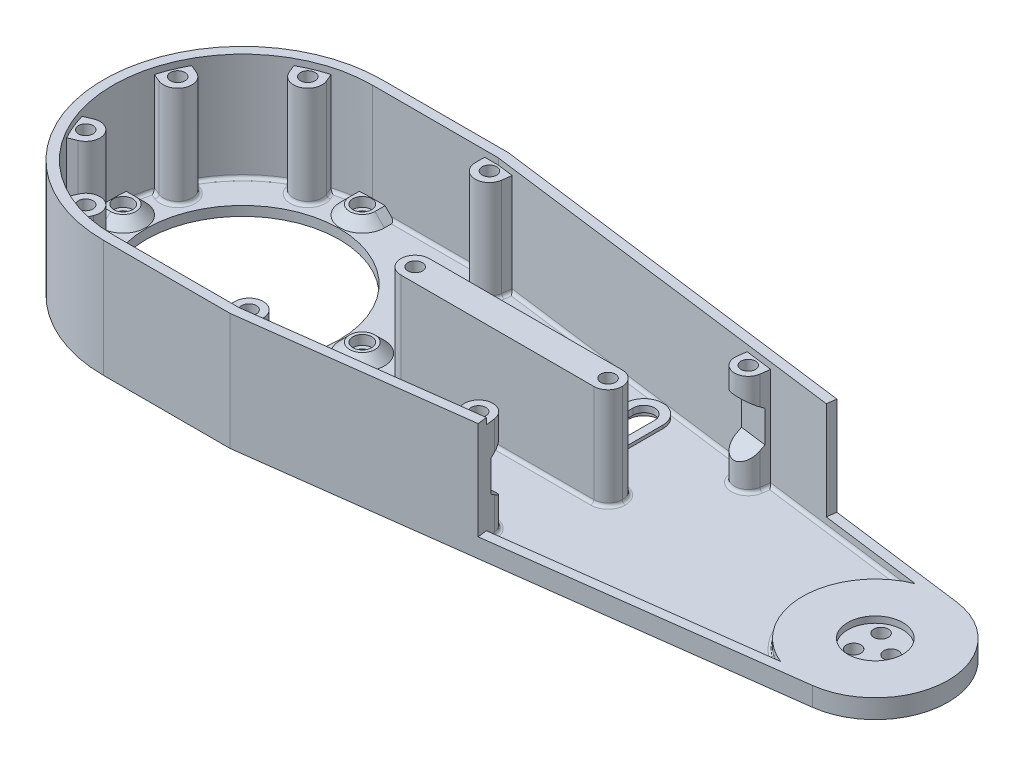
from build123d import *

# Parameters (mm, degrees)
SKETCH1_R              = 30.5
SKETCH1_R_2            = 1.6999999999999995
SKETCH1_R_3            = 1.6999999999999997
BOSS_EXTRUDE1_DEPTH    = 3
BOSS_EXTRUDE2_DEPTH    = 34
SKETCH3_R              = 4.000000000000006
SKETCH3_R_2            = 3.0000000000000013
SKETCH3_R_3            = 2.9999999999999982
SKETCH3_R_4            = 2.999999999999999
BOSS_EXTRUDE3_DEPTH    = 3
BOSS_EXTRUDE6_DEPTH    = 3
SKETCH4_R              = 8.699999999999998
CUT_EXTRUDE1_DEPTH     = 1
SKETCH5_R              = 8.699999999999998
BOSS_EXTRUDE4_DEPTH    = 3
BOSS_EXTRUDE5_DEPTH    = 32
SKETCH10_R             = 2.2999999999999994
SKETCH10_R_2           = 2.3000000000000003
SKETCH10_R_3           = 2.300000000000007
SKETCH10_R_4           = 2.3000000000000074
SKETCH10_R_5           = 2.3000000000000216
SKETCH10_R_6           = 2.300000000000006
CUT_EXTRUDE3_DEPTH     = 7
CHAMFER1_SIZE          = 3
CUT_EXTRUDE5_DEPTH     = 9
CUT_EXTRUDE6_DEPTH     = 8.6
SKETCH15_R             = 2.3000000000000065
SKETCH15_R_2           = 2.3000000000000074
CUT_EXTRUDE7_DEPTH     = 8
FILLET1_R              = 4.5
CUT_EXTRUDE8_START     = -2
CUT_EXTRUDE8_OUTLINE_W = 72.00000000000001
CUT_EXTRUDE8_OUTLINE_H = 12
CUT_EXTRUDE8_OUTLINE_R = 2.3
CUT_EXTRUDE8_DEPTH     = 2
SKETCH18_R             = 8.699999999999998
BOSS_EXTRUDE7_DEPTH    = 2
CUT_EXTRUDE9_REACH     = 231.682
SKETCH19_R             = 2.300000000000006
BOSS_EXTRUDE8_DEPTH    = 31
CUT_EXTRUDE10_DEPTH    = 10
BOSS_EXTRUDE9_START    = 1
BOSS_EXTRUDE9_DEPTH    = 1
CUT_EXTRUDE13_DEPTH    = 2
FILLET3_R              = 1


# Read off the part's stored shape, not the designer's step: Cut-Extrude8
# Some blends are built 0.0001 mm under size
with BuildPart() as part:
    # Sketch1 → Boss-Extrude1 (new body)
    with BuildSketch(Plane(origin=(0, 0, 0), x_dir=(1, 0, 0), z_dir=(0, 1, 0))):
        with BuildLine():
            Line((0, 44.00000000000001), (40.00000000000001, 44))
            Line((40.00000000000001, 44), (202.96593996902774, 22.807963523737147))
            ThreePointArc((202.96593996902774, 22.807963523737147), (223, 0), (202.96593996902774, -22.807963523737147))
            Line((202.96593996902774, -22.807963523737147), (40.00000000000001, -44))
            Line((40.00000000000001, -44), (0, -44.00000000000001))
            ThreePointArc((0, -44.00000000000001), (-44.00000000000001, 5.39e-15), (0, 44.00000000000001))
        make_face()
        with Locations(Location((0, 0, 0), (0, 0, 270))):
            Circle(SKETCH1_R, mode=Mode.SUBTRACT)
        with Locations(Location((-37.8, -8.39e-15, 0), (0, 0, 270))):
            Circle(SKETCH1_R_2, mode=Mode.SUBTRACT)
        with Locations(Location((-1.041e-14, 37.8, 0), (0, 0, 270))):
            Circle(SKETCH1_R_3, mode=Mode.SUBTRACT)
        with Locations(Location((37.8, 1.301e-14, 0), (0, 0, 270))):
            Circle(SKETCH1_R_2, mode=Mode.SUBTRACT)
        with Locations(Location((1.561e-14, -37.8, 0), (0, 0, 270))):
            Circle(SKETCH1_R_3, mode=Mode.SUBTRACT)
    extrude(amount=BOSS_EXTRUDE1_DEPTH)

    # Sketch2 → Boss-Extrude2 (add)
    with BuildSketch(Plane(origin=(0, 3, 0), x_dir=(1, 0, 0), z_dir=(0, 1, 0))):
        with BuildLine():
            Line((0, -44.00000000000001), (40.00000000000001, -44))
            Line((40.00000000000001, -44), (109.41554115919999, -34.97322618122002))
            Line((109.41554115919999, -34.97322618122002), (109.02867942410941, -31.998274417254336))
            Line((109.02867942410941, -31.998274417254336), (39.805758230172025, -41))
            Line((39.805758230172025, -41), (-7.53e-15, -41))
            ThreePointArc((-7.53e-15, -41), (-41, 5.02e-15), (5.5e-16, 41))
            Line((5.5e-16, 41), (39.80575823017201, 40.99999999999994))
            Line((39.80575823017201, 40.99999999999994), (138.77819706376658, 28.129657066348578))
            Line((138.77819706376658, 28.129657066348578), (139.16505879885716, 31.104608830314316))
            Line((139.16505879885716, 31.104608830314316), (40.00000000000001, 44))
            Line((40.00000000000001, 44), (0, 44.00000000000001))
            ThreePointArc((0, 44.00000000000001), (-44.00000000000001, 5.39e-15), (0, -44.00000000000001))
        make_face()
        Polygon((50, 4.500000000000011), (120.00000000000001, 4.500000000000014), (120.00000000000001, -4.499999999999985), (50, -4.4999999999999885), align=None)
    extrude(amount=BOSS_EXTRUDE2_DEPTH)

    # Sketch3 → Boss-Extrude3 (add)
    # profile 1 of 4: a face of its own
    with BuildSketch(Plane(origin=(0, 3, 0), x_dir=(1, 0, 0), z_dir=(0, 1, 0))):
        with Locations(Location((37.8, 1.301e-14, 0), (0, 0, 270))):
            Circle(SKETCH3_R)
        with Locations(Location((37.8, 1.301e-14, 0), (0, 0, 270))):
            Circle(SKETCH3_R_2, mode=Mode.SUBTRACT)
    # profile 2 of 4: a face of its own
    with BuildSketch(Plane(origin=(0, 3, 0), x_dir=(1, 0, 0), z_dir=(0, 1, 0))):
        with BuildLine():
            Line((-37.8, 3.9999999999999973), (-40.80441152620634, 3.9999999999999973))
            ThreePointArc((-40.80441152620634, 3.9999999999999973), (-41.00000000000001, -1.319e-14), (-40.80441152620633, -4.000000000000015))
            Line((-40.80441152620633, -4.000000000000015), (-37.8, -4.000000000000015))
            ThreePointArc((-37.8, -4.000000000000015), (-33.79999999999999, -8.39e-15), (-37.8, 3.9999999999999973))
        make_face()
        with Locations(Location((-37.8, -8.39e-15, 0), (0, 0, 270))):
            Circle(SKETCH3_R_2, mode=Mode.SUBTRACT)
    # profile 3 of 4: a face of its own
    with BuildSketch(Plane(origin=(0, 3, 0), x_dir=(1, 0, 0), z_dir=(0, 1, 0))):
        with BuildLine():
            Line((-3.999999999999883, 37.80000000000001), (-3.9999999999998725, 40.804411526206344))
            ThreePointArc((-3.9999999999998725, 40.804411526206344), (1.2996e-13, 41.00000000000001), (4.000000000000139, 40.80441152620632))
            Line((4.000000000000139, 40.80441152620632), (4.00000000000013, 37.79999999999998))
            ThreePointArc((4.00000000000013, 37.79999999999998), (1.0864e-13, 33.79999999999999), (-3.999999999999883, 37.80000000000001))
        make_face()
        with Locations(Location((1.2358e-13, 37.8, 0), (0, 0, 270))):
            Circle(SKETCH3_R_3, mode=Mode.SUBTRACT)
    # profile 4 of 4: a face of its own
    with BuildSketch(Plane(origin=(0, 3, 0), x_dir=(1, 0, 0), z_dir=(0, 1, 0))):
        with BuildLine():
            Line((3.9999999999996194, -37.80000000000004), (3.999999999999587, -40.804411526206366))
            ThreePointArc((3.999999999999587, -40.804411526206366), (-4.1627e-13, -41.00000000000001), (-4.000000000000425, -40.804411526206295))
            Line((-4.000000000000425, -40.804411526206295), (-4.000000000000393, -37.79999999999996))
            ThreePointArc((-4.000000000000393, -37.79999999999996), (-3.4822e-13, -33.79999999999999), (3.9999999999996194, -37.80000000000004))
        make_face()
        with Locations(Location((-3.8754e-13, -37.8, 0), (0, 0, 270))):
            Circle(SKETCH3_R_4, mode=Mode.SUBTRACT)
    extrude(amount=BOSS_EXTRUDE3_DEPTH)

    # Sketch16 → Boss-Extrude6 (add)
    with BuildSketch(Plane(origin=(0, 3, 0), x_dir=(1, 0, 0), z_dir=(0, 1, 0))):
        with BuildLine():
            Line((4.000000000000139, 40.80441152620632), (4.000000000000139, 40.99999999999999))
            Line((4.000000000000139, 40.99999999999999), (5.718e-14, 40.99999999999999))
            ThreePointArc((5.718e-14, 40.99999999999999), (2.002389500764186, 40.95107368906498), (4.000000000000139, 40.80441152620632))
        make_face()
        with BuildLine():
            Line((3.999999999999583, -40.80441152620636), (3.9999999999995888, -41))
            Line((3.9999999999995888, -41), (-7.53e-15, -41))
            ThreePointArc((-7.53e-15, -41), (2.0023895007638766, -40.951073689064984), (3.999999999999583, -40.80441152620636))
        make_face()
    extrude(amount=BOSS_EXTRUDE6_DEPTH)

    # Sketch4 → Cut-Extrude1 (cut)
    with BuildSketch(Plane(origin=(0, 3, 0), x_dir=(1, 0, 0), z_dir=(0, 1, 0))):
        with Locations(Location((200, 0, 0), (0, 0, 270))):
            Circle(SKETCH4_R)
    extrude(amount=-CUT_EXTRUDE1_DEPTH, mode=Mode.SUBTRACT)

    # Sketch5 → Boss-Extrude4 (add)
    with BuildSketch(Plane(origin=(0, 3, 0), x_dir=(1, 0, 0), z_dir=(0, 1, 0))):
        with BuildLine():
            Line((109.41554115919999, -34.97322618122002), (109.02867942410941, -31.998274417254336))
            Line((109.02867942410941, -31.998274417254336), (191.31609263344478, -21.297646650489078))
            ThreePointArc((191.31609263344478, -21.297646650489078), (177, 3.3988e-13), (191.3160926334454, 21.297646650489323))
            Line((191.3160926334454, 21.297646650489323), (138.77819706376658, 28.129657066348578))
            Line((138.77819706376658, 28.129657066348578), (139.16505879885716, 31.104608830314316))
            Line((139.16505879885716, 31.104608830314316), (202.96593996902774, 22.807963523737147))
            ThreePointArc((202.96593996902774, 22.807963523737147), (223.00000000000003, -5.11e-15), (202.96593996902774, -22.80796352373717))
            Line((202.96593996902774, -22.80796352373717), (109.41554115919999, -34.97322618122002))
        make_face()
        with Locations(Location((200, 0, 0), (0, 0, 270))):
            Circle(SKETCH5_R, mode=Mode.SUBTRACT)
    extrude(amount=BOSS_EXTRUDE4_DEPTH)

    # Sketch7 → Boss-Extrude5 (add)
    with BuildSketch(Plane(origin=(0, 3, 0), x_dir=(1, 0, 0), z_dir=(0, 1, 0))):
        with BuildLine():
            Line((-33.38534678978598, 18.699428326174232), (-35.92814093391829, 19.75268814699673))
            ThreePointArc((-35.92814093391829, 19.75268814699673), (-37.87906083296274, 15.690020726968717), (-39.37229182520411, 11.437772354395154))
            Line((-39.37229182520411, 11.437772354395154), (-36.82949768107179, 10.384512533572654))
            ThreePointArc((-36.82949768107179, 10.384512533572654), (-30.949964339128098, 12.819894984230533), (-33.38534678978598, 18.699428326174232))
        make_face()
        with BuildLine():
            Line((-10.38451253357259, 36.82949768107181), (-11.437772354395067, 39.37229182520414))
            ThreePointArc((-11.437772354395067, 39.37229182520414), (-15.690020726968635, 37.879060832962786), (-19.75268814699666, 35.928140933918336))
            Line((-19.75268814699666, 35.928140933918336), (-18.699428326174175, 33.38534678978601))
            ThreePointArc((-18.699428326174175, 33.38534678978601), (-12.819894984230487, 30.949964339128123), (-10.38451253357259, 36.82949768107181))
        make_face()
        with BuildLine():
            Line((-18.699428326174225, -33.385346789785984), (-19.752688146996732, -35.92814093391828))
            ThreePointArc((-19.752688146996732, -35.92814093391828), (-15.690020726968717, -37.87906083296273), (-11.437772354395138, -39.37229182520411))
            Line((-11.437772354395138, -39.37229182520411), (-10.384512533572646, -36.82949768107179))
            ThreePointArc((-10.384512533572646, -36.82949768107179), (-12.81989498423053, -30.949964339128098), (-18.699428326174225, -33.385346789785984))
        make_face()
        with BuildLine():
            Line((-36.829497681071814, -10.384512533572599), (-39.37229182520413, -11.437772354395063))
            ThreePointArc((-39.37229182520413, -11.437772354395063), (-37.87906083296277, -15.690020726968626), (-35.928140933918336, -19.752688146996658))
            Line((-35.928140933918336, -19.752688146996658), (-33.385346789786006, -18.699428326174182))
            ThreePointArc((-33.385346789786006, -18.699428326174182), (-30.949964339128123, -12.819894984230487), (-36.829497681071814, -10.384512533572599))
        make_face()
        with BuildLine():
            Line((35.50000000000001, 38), (35.50000000000001, 40.99999999999999))
            Line((35.50000000000001, 40.99999999999999), (39.80575823017201, 40.99999999999994))
            Line((39.80575823017201, 40.99999999999994), (44.8428292450037, 40.3449809653469))
            Line((44.8428292450037, 40.3449809653469), (44.46242764594859, 37.41970739736415))
            ThreePointArc((44.46242764594859, 37.41970739736415), (39.70924615803792, 33.50940291237521), (35.50000000000001, 38))
        make_face()
        with BuildLine():
            Line((35.50000000000001, -38), (35.50000000000001, -40.99999999999999))
            Line((35.50000000000001, -40.99999999999999), (39.80575823017201, -40.99999999999994))
            Line((39.80575823017201, -40.99999999999994), (44.8428292450037, -40.3449809653469))
            Line((44.8428292450037, -40.3449809653469), (44.46242764594859, -37.41970739736415))
            ThreePointArc((44.46242764594859, -37.41970739736415), (39.70924615803792, -33.50940291237521), (35.50000000000001, -38))
        make_face()
        with BuildLine():
            Line((99.71696239712172, -30.18390785856034), (100.10382413221228, -33.15885962252599))
            Line((100.10382413221228, -33.15885962252599), (109.02867942410941, -31.998274417254336))
            Line((109.02867942410941, -31.998274417254336), (108.64181768901885, -29.02332265328862))
            ThreePointArc((108.64181768901885, -29.02332265328862), (103.59909744043442, -25.141187609975912), (99.71696239712172, -30.18390785856034))
        make_face()
        with BuildLine():
            Line((138.39133532867604, 25.154705302382883), (138.77819706376658, 28.129657066348578))
            Line((138.77819706376658, 28.129657066348578), (130.25000200706492, 29.238660706941687))
            Line((130.25000200706492, 29.238660706941687), (129.86314027197434, 26.26370894297582))
            ThreePointArc((129.86314027197434, 26.26370894297582), (133.57273598002874, 21.445109594328464), (138.39133532867604, 25.154705302382883))
        make_face()
    extrude(amount=BOSS_EXTRUDE5_DEPTH)

    # Sketch10 → Cut-Extrude3 (cut)
    with BuildSketch(Plane(origin=(0, 35, 0), x_dir=(1, 0, 0), z_dir=(0, 1, 0))):
        with Locations(Location((-35.10742223542891, -14.541970429873391, 0), (0, 0, 270))):
            Circle(SKETCH10_R)
        with Locations(Location((-14.541970429873432, -35.107422235428885, 0), (0, 0, 270))):
            Circle(SKETCH10_R_2)
        with Locations(Location((-35.107422235428885, 14.54197042987344, 0), (0, 0, 270))):
            Circle(SKETCH10_R_3)
        with Locations(Location((-14.541970429873384, 35.10742223542891, 0), (0, 0, 270))):
            Circle(SKETCH10_R_2)
        with Locations(Location((40.00000000000001, -38, 0), (0, 0, 270))):
            Circle(SKETCH10_R_4)
        with Locations(Location((104.17939004307028, -29.603615255924478, 0), (0, 0, 270))):
            Circle(SKETCH10_R_5)
        with Locations(Location((40.00000000000001, 38, 0), (0, 0, 270))):
            Circle(SKETCH10_R_4)
        with Locations(Location((134.12723780032522, 25.709207122679338, 0), (0, 0, 270))):
            Circle(SKETCH10_R_6)
    extrude(amount=-CUT_EXTRUDE3_DEPTH, mode=Mode.SUBTRACT)

    # Chamfer1
    chamfer1_edges = [part.edges().sort_by_distance(p)[0] for p in [
        (37.8, 3, -4.0000000000000195),
        (3.999999999999604, 3, 39.40000000000002),
        (-4.000000000000409, 3, 39.30220576310313),
        (-3.4897e-13, 3, 33.79999999999999),
        (-3.999999999999878, 3, -39.302205763103174),
        (4.000000000000134, 3, -39.39999999999999),
        (1.0916e-13, 3, -33.79999999999998),
        (-39.30220576310316, 3, 4.000000000000015),
        (-39.30220576310317, 3, -3.9999999999999973),
        (-33.79999999999999, 3, 9.02e-15),
    ]]
    chamfer(chamfer1_edges, length=CHAMFER1_SIZE - 0.0001)  # a hair under: the kernel refuses the full size

    # Sketch13 → Cut-Extrude5 (cut)
    with BuildSketch(Plane(origin=(103.123778921788, 0, -13.410181814040275), x_dir=(-0.1289539116968592, 0, -0.9916505879885711), z_dir=(0.991650587988571, 0, -0.12895391169685919))):
        Polygon((-44.00337436634009, 25), (-44.00337436634009, 15), (-38.29078233937168, 11.000000000000055), (-38.29078233937168, 29.000000000000004), align=None)
    extrude(amount=-CUT_EXTRUDE5_DEPTH, mode=Mode.SUBTRACT)

    # Sketch14 → Cut-Extrude6 (cut)
    with BuildSketch(Plane(origin=(132.87329656144564, 0, 17.27879916494519), x_dir=(0.12895391169685194, 0, -0.9916505879885721), z_dir=(0.9916505879885721, 0, 0.12895391169685194))):
        Polygon((38.49078233937063, 29.000000000000004), (44.20337436633917, 25), (44.20337436633917, 15), (38.490782339370845, 11.000000000000052), align=None)
    extrude(amount=-CUT_EXTRUDE6_DEPTH, mode=Mode.SUBTRACT)

    # Sketch15 → Cut-Extrude7 (cut)
    with BuildSketch(Plane(origin=(0, 37.00000000000001, 0), x_dir=(1, 0, 0), z_dir=(0, 1, 0))):
        with Locations(Location((54.50000000000002, 0, 0), (0, 0, 270))):
            Circle(SKETCH15_R)
        with Locations(Location((115.49999999999999, 0, 0), (0, 0, 90))):
            Circle(SKETCH15_R_2)
    extrude(amount=-CUT_EXTRUDE7_DEPTH, mode=Mode.SUBTRACT)

    # Fillet1
    fillet1_edges = [part.edges().sort_by_distance(p)[0] for p in [
        (120.00000000000001, 20, -4.500000000000014),
        (120.00000000000001, 20, 4.499999999999985),
        (50, 20, -4.500000000000011),
        (50, 20, 4.4999999999999885),
    ]]
    fillet(fillet1_edges, radius=FILLET1_R - 0.0001)  # a hair under: the kernel refuses the full size

    # Cut-Extrude8 outline → Cut-Extrude8 (cut)
    with BuildSketch(Plane(origin=(0, 37.00000000000001, 0), x_dir=(1, 0, 0), z_dir=(0, 1, 0)).offset(CUT_EXTRUDE8_START)):
        with Locations((85, 0)):
            Rectangle(CUT_EXTRUDE8_OUTLINE_W, CUT_EXTRUDE8_OUTLINE_H)
        with Locations((54.5, 0)):
            Circle(CUT_EXTRUDE8_OUTLINE_R, mode=Mode.SUBTRACT)
        with Locations((115.5, 0)):
            Circle(CUT_EXTRUDE8_OUTLINE_R, mode=Mode.SUBTRACT)
    extrude(amount=CUT_EXTRUDE8_DEPTH, mode=Mode.SUBTRACT)

    # Sketch18 → Boss-Extrude7 (add)
    with BuildSketch(Plane(origin=(0, 2, 0), x_dir=(1, 0, 0), z_dir=(0, 1, 0))):
        with Locations(Location((200, 0, 0), (0, 0, 270))):
            Circle(SKETCH18_R)
    extrude(amount=BOSS_EXTRUDE7_DEPTH)

    # Sketch19 → Cut-Extrude9 (cut, up to next)
    with BuildSketch(Plane(origin=(0, 4, 0), x_dir=(1, 0, 0), z_dir=(0, 1, 0)), mode=Mode.PRIVATE) as cut_extrude9_sk1:
        with Locations(Location((205.00000000000003, 0, 0), (0, 0, 270))):
            Circle(SKETCH19_R)
    cut_extrude9_tool1 = extrude(cut_extrude9_sk1.sketch, amount=-CUT_EXTRUDE9_REACH, mode=Mode.PRIVATE) & part.part
    # Sketch19 → Cut-Extrude9 (cut, up to next)
    with BuildSketch(Plane(origin=(0, 4, 0), x_dir=(1, 0, 0), z_dir=(0, 1, 0)), mode=Mode.PRIVATE) as cut_extrude9_sk2:
        with Locations(Location((197.49999999999994, -4.330127018922214, 0), (0, 0, 270))):
            Circle(SKETCH19_R)
    cut_extrude9_tool2 = extrude(cut_extrude9_sk2.sketch, amount=-CUT_EXTRUDE9_REACH, mode=Mode.PRIVATE) & part.part
    # Sketch19 → Cut-Extrude9 (cut, up to next)
    with BuildSketch(Plane(origin=(0, 4, 0), x_dir=(1, 0, 0), z_dir=(0, 1, 0)), mode=Mode.PRIVATE) as cut_extrude9_sk3:
        with Locations(Location((197.5, 4.330127018922214, 0), (0, 0, 270))):
            Circle(SKETCH19_R)
    cut_extrude9_tool3 = extrude(cut_extrude9_sk3.sketch, amount=-CUT_EXTRUDE9_REACH, mode=Mode.PRIVATE) & part.part
    add(cut_extrude9_tool1.solids().sort_by_distance((205, 4, 0))[0], mode=Mode.SUBTRACT)
    add(cut_extrude9_tool2.solids().sort_by_distance((197.5, 4, 4.330127))[0], mode=Mode.SUBTRACT)
    add(cut_extrude9_tool3.solids().sort_by_distance((197.5, 4, -4.330127))[0], mode=Mode.SUBTRACT)

    # Sketch20 → Boss-Extrude8 (add)
    with BuildSketch(Plane(origin=(0, 6, 0), x_dir=(1, 0, 0), z_dir=(0, 1, 0))):
        Polygon((138.77819706376658, 28.129657066348578), (139.16505879885716, 31.104608830314316), (159.38701982151375, 28.47495176396575), (159.00015808642317, 25.5), align=None)
    extrude(amount=BOSS_EXTRUDE8_DEPTH)

    # Sketch21 → Cut-Extrude10 (cut)
    with BuildSketch(Plane(origin=(0, 3, 0), x_dir=(1, 0, 0), z_dir=(0, 1, 0))):
        with BuildLine():
            Line((103.4, 26.836180439024222), (103.40000000000002, 10.836180439024222))
            ThreePointArc((103.40000000000002, 10.836180439024222), (100, 7.436180439024216), (96.6, 10.836180439024222))
            Line((96.6, 10.836180439024222), (96.60000000000001, 26.836180439024222))
            ThreePointArc((96.60000000000001, 26.836180439024222), (100, 30.236180439024228), (103.4, 26.836180439024222))
        make_face()
    extrude(amount=-CUT_EXTRUDE10_DEPTH, mode=Mode.SUBTRACT)

    # Sketch22 → Boss-Extrude9 (add)
    with BuildSketch(Plane(origin=(0, 3, 0), x_dir=(1, 0, 0), z_dir=(0, 1, 0)).offset(BOSS_EXTRUDE9_START)):
        with BuildLine():
            Line((94.00000000000001, 26.836180439024222), (94.00000000000001, 10.83618043902422))
            ThreePointArc((94.00000000000001, 10.83618043902422), (100, 4.836180439024236), (106.00000000000001, 10.836180439024222))
            Line((106.00000000000001, 10.836180439024222), (106.00000000000001, 26.836180439024222))
            ThreePointArc((106.00000000000001, 26.836180439024222), (100, 32.83618043902423), (94.00000000000001, 26.836180439024222))
        make_face()
        with BuildLine():
            Line((96.60000000000001, 26.836180439024222), (96.6, 10.836180439024222))
            ThreePointArc((96.6, 10.836180439024222), (100, 7.436180439024216), (103.40000000000002, 10.836180439024222))
            Line((103.40000000000002, 10.836180439024222), (103.4, 26.836180439024222))
            ThreePointArc((103.4, 26.836180439024222), (100, 30.236180439024228), (96.60000000000001, 26.836180439024222))
        make_face(mode=Mode.SUBTRACT)
    extrude(amount=-BOSS_EXTRUDE9_DEPTH)

    # Sketch23 → Cut-Extrude13 (cut)
    with BuildSketch(Plane.XZ):
        with BuildLine():
            Line((95, -10.836180439024222), (94.99999999999999, -26.836180439024222))
            ThreePointArc((94.99999999999999, -26.836180439024222), (100, -31.836180439024236), (105.00000000000003, -26.836180439024222))
            Line((105.00000000000003, -26.836180439024222), (105.00000000000001, -10.83618043902422))
            ThreePointArc((105.00000000000001, -10.83618043902422), (100, -5.836180439024208), (95, -10.836180439024222))
        make_face()
    extrude(amount=-CUT_EXTRUDE13_DEPTH, mode=Mode.SUBTRACT)

    # Fillet3
    # the kernel refuses this fillet: 1 mm, written as the material it adds along each edge
    with BuildSketch(Plane(origin=(130.57238678630705, 3, -31.71778717691312), x_dir=(-0.991650587988572, 0, -0.12895391169685236), z_dir=(-0.12895391169685236, 0, 0.991650587988572))) as fillet3_piece_1:
        with BuildLine():
            CenterArc((FILLET3_R, -FILLET3_R), FILLET3_R, 90, 90)
            Line((4.6e-16, -FILLET3_R), (0, 0))
            Line((0, 0), (FILLET3_R, 0))
        make_face()
    extrude(amount=5.5000000000001545)
    with BuildSketch(Plane(origin=(138.39133532867604, 3, -25.154705302382883), x_dir=(0.9916505879885722, 0, 0.12895391169685033), z_dir=(0.1289539116968503, 0, -0.9916505879885722))) as fillet3_piece_2:
        with BuildLine():
            CenterArc((FILLET3_R, -FILLET3_R), FILLET3_R, 90, 90)
            Line((-9.2e-16, -FILLET3_R), (0, 0))
            Line((0, 0), (FILLET3_R, 0))
        make_face()
    extrude(amount=5.499999999999981)
    with BuildSketch(Plane(origin=(35.50000000000001, 3, -38), x_dir=(-1, 0, 0), z_dir=(0, 0, -1))) as fillet3_piece_3:
        with BuildLine():
            CenterArc((FILLET3_R, FILLET3_R), FILLET3_R, 180, 90)
            Line((0, FILLET3_R), (0, 0))
            Line((0, 0), (FILLET3_R, 0))
        make_face()
    extrude(amount=5.499999999999993)
    with BuildSketch(Plane(origin=(45.16521402424584, 3, -42.82410743531833), x_dir=(0.9916505879885714, 0, 0.1289539116968562), z_dir=(-0.12895391169685616, 0, 0.9916505879885714))) as fillet3_piece_4:
        with BuildLine():
            CenterArc((FILLET3_R, FILLET3_R), FILLET3_R, 180, 90)
            Line((9.2e-16, FILLET3_R), (0, 0))
            Line((0, 0), (FILLET3_R, 0))
        make_face()
    extrude(amount=5.44990352793142)
    with BuildSketch(Plane(origin=(-20.70939672790938, 3, -38.23783976519656), x_dir=(-0.923879532511288, 0, 0.3826834323650872), z_dir=(0.3826834323650871, 0, 0.9238795325112878))) as fillet3_piece_5:
        with BuildLine():
            CenterArc((FILLET3_R, -FILLET3_R), FILLET3_R, 90, 90)
            Line((3.28e-15, -FILLET3_R), (0, 0))
            Line((0, 0), (FILLET3_R, 0))
        make_face()
    extrude(amount=5.252300548558003)
    with BuildSketch(Plane(origin=(-10.38451253357259, 3, -36.82949768107181), x_dir=(0.9238795325112895, 0, -0.3826834323650835), z_dir=(-0.38268343236508345, 0, -0.9238795325112894))) as fillet3_piece_6:
        with BuildLine():
            CenterArc((FILLET3_R, -FILLET3_R), FILLET3_R, 90, 90)
            Line((3.28e-15, -FILLET3_R), (0, 0))
            Line((0, 0), (FILLET3_R, 0))
        make_face()
    extrude(amount=5.252300548558002)
    with BuildSketch(Plane(origin=(-41.68199065648233, 3, -12.394480935307882), x_dir=(-0.38268343236509245, 0, 0.9238795325112857), z_dir=(0.9238795325112857, 0, 0.38268343236509245))) as fillet3_piece_7:
        with BuildLine():
            CenterArc((FILLET3_R, -FILLET3_R), FILLET3_R, 90, 90)
            Line((5.6e-16, -FILLET3_R), (0, 0))
            Line((0, 0), (FILLET3_R, 0))
        make_face()
    extrude(amount=5.252300548557993)
    with BuildSketch(Plane(origin=(-33.38534678978598, 3, -18.699428326174232), x_dir=(0.3826834323650914, 0, -0.9238795325112862), z_dir=(-0.9238795325112862, 0, -0.3826834323650914))) as fillet3_piece_8:
        with BuildLine():
            CenterArc((FILLET3_R, -FILLET3_R), FILLET3_R, 90, 90)
            Line((0, -FILLET3_R), (0, 0))
            Line((0, 0), (FILLET3_R, 0))
        make_face()
    extrude(amount=5.252300548558005)
    with BuildSketch(Plane(origin=(-38.237839765196554, 3, 20.709396727909365), x_dir=(0.38268343236508295, 0, 0.9238795325112896), z_dir=(0.9238795325112897, 0, -0.38268343236508295))) as fillet3_piece_9:
        with BuildLine():
            CenterArc((FILLET3_R, -FILLET3_R), FILLET3_R, 90, 90)
            Line((5.6e-16, -FILLET3_R), (0, 0))
            Line((0, 0), (FILLET3_R, 0))
        make_face()
    extrude(amount=5.252300548558001)
    with BuildSketch(Plane(origin=(-36.829497681071814, 3, 10.384512533572599), x_dir=(-0.38268343236508146, 0, -0.9238795325112903), z_dir=(-0.9238795325112903, 0, 0.38268343236508146))) as fillet3_piece_10:
        with BuildLine():
            CenterArc((FILLET3_R, -FILLET3_R), FILLET3_R, 90, 90)
            Line((0, -FILLET3_R), (0, 0))
            Line((0, 0), (FILLET3_R, 0))
        make_face()
    extrude(amount=5.25230054855799)
    with BuildSketch(Plane(origin=(-12.394480935307868, 3, 41.68199065648233), x_dir=(0.9238795325112868, 0, 0.3826834323650898), z_dir=(0.3826834323650897, 0, -0.9238795325112868))) as fillet3_piece_11:
        with BuildLine():
            CenterArc((FILLET3_R, -FILLET3_R), FILLET3_R, 90, 90)
            Line((6.56e-15, -FILLET3_R), (0, 0))
            Line((0, 0), (FILLET3_R, 0))
        make_face()
    extrude(amount=5.252300548557994)
    with BuildSketch(Plane(origin=(-18.699428326174225, 3, 33.385346789785984), x_dir=(-0.9238795325112836, 0, -0.3826834323650974), z_dir=(-0.3826834323650974, 0, 0.9238795325112836))) as fillet3_piece_12:
        with BuildLine():
            CenterArc((FILLET3_R, -FILLET3_R), FILLET3_R, 90, 90)
            Line((0, -FILLET3_R), (0, 0))
            Line((0, 0), (FILLET3_R, 0))
        make_face()
    extrude(amount=5.252300548557988)
    with BuildSketch(Plane(origin=(45.16521402424584, 3, 42.82410743531833), x_dir=(0.9916505879885714, 0, -0.1289539116968562), z_dir=(-0.12895391169685616, 0, -0.9916505879885714))) as fillet3_piece_13:
        with BuildLine():
            CenterArc((FILLET3_R, -FILLET3_R), FILLET3_R, 90, 90)
            Line((9.2e-16, -FILLET3_R), (0, 0))
            Line((0, 0), (FILLET3_R, 0))
        make_face()
    extrude(amount=5.44990352793142)
    with BuildSketch(Plane(origin=(35.50000000000001, 3, 38), x_dir=(-1, 0, 0), z_dir=(0, 0, 1))) as fillet3_piece_14:
        with BuildLine():
            CenterArc((FILLET3_R, -FILLET3_R), FILLET3_R, 90, 90)
            Line((0, -FILLET3_R), (0, 0))
            Line((0, 0), (FILLET3_R, 0))
        make_face()
    extrude(amount=5.499999999999993)
    with BuildSketch(Plane(origin=(109.35106420335157, 3, 34.47740088722577), x_dir=(0.9916505879885718, 0, -0.12895391169685408), z_dir=(-0.12895391169685408, 0, -0.9916505879885718))) as fillet3_piece_15:
        with BuildLine():
            CenterArc((FILLET3_R, -FILLET3_R), FILLET3_R, 90, 90)
            Line((9.2e-16, -FILLET3_R), (0, 0))
            Line((0, 0), (FILLET3_R, 0))
        make_face()
    extrude(amount=5.500000000000006)
    with BuildSketch(Plane(origin=(99.71696239712172, 3, 30.18390785856034), x_dir=(-0.9916505879885714, 0, 0.12895391169685697), z_dir=(0.12895391169685694, 0, 0.9916505879885713))) as fillet3_piece_16:
        with BuildLine():
            CenterArc((FILLET3_R, -FILLET3_R), FILLET3_R, 90, 90)
            Line((0, -FILLET3_R), (0, 0))
            Line((0, 0), (FILLET3_R, 0))
        make_face()
    extrude(amount=5.49999999999994)
    with BuildSketch(Plane(origin=(54.4999, 3, -4.500000000000011), x_dir=(-5e-17, 0, -1), z_dir=(1, 0, -5e-17))) as fillet3_piece_17:
        with BuildLine():
            CenterArc((FILLET3_R, FILLET3_R), FILLET3_R, 180, 90)
            Line((0, FILLET3_R), (0, 0))
            Line((0, 0), (FILLET3_R, 0))
        make_face()
    extrude(amount=61.00020000000002)
    with BuildSketch(Plane(origin=(54.4999, 3, -0.00010000000001131), x_dir=(0, 0, -1), z_dir=(1, 0, 0))) as fillet3_piece_18:
        with BuildLine():
            CenterArc((4.4999 + FILLET3_R, FILLET3_R), FILLET3_R, 180, 90)
            Line((4.4999, FILLET3_R), (4.4999, 0))
            Line((4.4999, 0), (4.4999 + FILLET3_R, 0))
        make_face()
    revolve(axis=Axis((54.4999, 3, -0.00010000000001131), (0, 1, 0)), revolution_arc=90)
    with BuildSketch(Plane(origin=(54.4999, 3, 9.999999998822e-05), x_dir=(-1, 0, -1.8e-16), z_dir=(1.8e-16, 0, -1))) as fillet3_piece_19:
        with BuildLine():
            CenterArc((4.499899999999997 + FILLET3_R, FILLET3_R), FILLET3_R, 180, 90)
            Line((4.499899999999997, FILLET3_R), (4.499899999999997, 0))
            Line((4.499899999999997, 0), (4.499899999999997 + FILLET3_R, 0))
        make_face()
    revolve(axis=Axis((54.4999, 3, 9.999999998822e-05), (0, 1, 0)), revolution_arc=90)
    with BuildSketch(Plane(origin=(115.50010000000002, 3, 4.499999999999985), x_dir=(5e-17, 0, 1), z_dir=(-1, 0, 5e-17))) as fillet3_piece_20:
        with BuildLine():
            CenterArc((FILLET3_R, FILLET3_R), FILLET3_R, 180, 90)
            Line((0, FILLET3_R), (0, 0))
            Line((0, 0), (FILLET3_R, 0))
        make_face()
    extrude(amount=61.00020000000002)
    with BuildSketch(Plane(origin=(115.50010000000002, 3, 9.999999998644e-05), x_dir=(1, 0, -1.8e-16), z_dir=(-1.8e-16, 0, -1))) as fillet3_piece_21:
        with BuildLine():
            CenterArc((4.499899999999997 + FILLET3_R, -FILLET3_R), FILLET3_R, 90, 90)
            Line((4.499899999999997, -FILLET3_R), (4.499899999999997, 0))
            Line((4.499899999999997, 0), (4.499899999999997 + FILLET3_R, 0))
        make_face()
    revolve(axis=Axis((115.50010000000002, 3, 9.999999998644e-05), (0, -1, 0)), revolution_arc=90)
    with BuildSketch(Plane(origin=(193.79521910341623, 3, 20.975261871247106), x_dir=(-0.12895391169685827, 0, -0.9916505879885712), z_dir=(-0.9916505879885712, 0, 0.12895391169685824))) as fillet3_piece_22:
        with BuildLine():
            CenterArc((FILLET3_R, -FILLET3_R), FILLET3_R, 90, 90)
            Line((-1.4e-16, -FILLET3_R), (0, 0))
            Line((0, 0), (FILLET3_R, 0))
        make_face()
    extrude(amount=87.98024950123235)
    with BuildSketch(Plane(origin=(136.29907059379514, 3, -28.452041845590717), x_dir=(-0.12895391169685577, 0, 0.9916505879885715), z_dir=(0.9916505879885715, 0, 0.12895391169685577))) as fillet3_piece_23:
        with BuildLine():
            CenterArc((FILLET3_R, -FILLET3_R), FILLET3_R, 90, 90)
            Line((0, -FILLET3_R), (0, 0))
            Line((0, 0), (FILLET3_R, 0))
        make_face()
    extrude(amount=57.98024950123291)
    with BuildSketch(Plane(origin=(134.1272378003252, 3, -25.709207122679313), x_dir=(-0.9916505879885705, 0, -0.12895391169686263), z_dir=(0.12895391169686263, 0, -0.9916505879885705))) as fillet3_piece_24:
        with BuildLine():
            CenterArc((4.299999999999992 + FILLET3_R, FILLET3_R), FILLET3_R, 180, 90)
            Line((4.299999999999992, FILLET3_R), (4.299999999999992, 0))
            Line((4.299999999999992, 0), (4.299999999999992 + FILLET3_R, 0))
        make_face()
    revolve(axis=Axis((134.1272378003252, 3, -25.709207122679313), (0, 1, 0)), revolution_arc=180.00000000000105)
    with BuildSketch(Plane(origin=(42.363702775032266, 3, -40.667365744589034), x_dir=(-0.12895391169685577, 0, 0.9916505879885715), z_dir=(0.9916505879885715, 0, 0.12895391169685577))) as fillet3_piece_25:
        with BuildLine():
            CenterArc((FILLET3_R, -FILLET3_R), FILLET3_R, 90, 90)
            Line((0, -FILLET3_R), (0, 0))
            Line((0, 0), (FILLET3_R, 0))
        make_face()
    extrude(amount=91.12627652981891)
    with BuildSketch(Plane(origin=(40.000000000000014, 3, -38.00000000000001), x_dir=(0.9916505879885713, 0, 0.12895391169685722), z_dir=(0.12895391169685722, 0, -0.9916505879885713))) as fillet3_piece_26:
        with BuildLine():
            CenterArc((4.500000000000002 + FILLET3_R, -FILLET3_R), FILLET3_R, 90, 90)
            Line((4.500000000000002, -FILLET3_R), (4.500000000000002, 0))
            Line((4.500000000000002, 0), (4.500000000000002 + FILLET3_R, 0))
        make_face()
    revolve(axis=Axis((40.000000000000014, 3, -38.00000000000001), (0, -1, 0)), revolution_arc=172.59085293331975)
    with BuildSketch(Plane(origin=(4.499900000000139, 3, -40.99999999999999), x_dir=(-1.43e-15, 0, 1), z_dir=(1, 0, 1.43e-15))) as fillet3_piece_27:
        with BuildLine():
            CenterArc((FILLET3_R, -FILLET3_R), FILLET3_R, 90, 90)
            Line((0, -FILLET3_R), (0, 0))
            Line((0, 0), (FILLET3_R, 0))
        make_face()
    extrude(amount=33.50009999999987)
    with BuildSketch(Plane(origin=(1.78e-15, 3, -1.78e-15), x_dir=(-0.33697031260173355, 0, -0.9415152725394793), z_dir=(-0.9415152725394793, 0, 0.33697031260173355))) as fillet3_piece_28:
        with BuildLine():
            CenterArc((40.99999999999999 - FILLET3_R, -FILLET3_R), FILLET3_R, 0, 90)
            Line((40.99999999999999, -FILLET3_R), (40.99999999999999, 0))
            Line((40.99999999999999, 0), (40.99999999999999 - FILLET3_R, 0))
        make_face()
    revolve(axis=Axis((1.78e-15, 3, -1.78e-15), (0, -1, 0)), revolution_arc=13.355825424689233)
    with BuildSketch(Plane(origin=(-14.541970429873384, 3, -35.10742223542891), x_dir=(-0.9238795325112871, 0, 0.3826834323650891), z_dir=(-0.3826834323650891, 0, -0.9238795325112871))) as fillet3_piece_29:
        with BuildLine():
            CenterArc((4.499999999999999 + FILLET3_R, FILLET3_R), FILLET3_R, 180, 90)
            Line((4.5, FILLET3_R), (4.499999999999999, 0))
            Line((4.499999999999999, 0), (4.499999999999999 + FILLET3_R, 0))
        make_face()
    revolve(axis=Axis((-14.541970429873384, 3, -35.10742223542891), (0, 1, 0)), revolution_arc=179.9999999999999)
    with BuildSketch(Plane(origin=(1.78e-15, 3, -1.78e-15), x_dir=(-0.9040271309589271, 0, -0.42747508288807995), z_dir=(-0.42747508288807995, 0, 0.9040271309589271))) as fillet3_piece_30:
        with BuildLine():
            CenterArc((41 - FILLET3_R, -FILLET3_R), FILLET3_R, 0, 90)
            Line((41, -FILLET3_R), (41, 0))
            Line((41, 0), (41 - FILLET3_R, 0))
        make_face()
    revolve(axis=Axis((1.78e-15, 3, -1.78e-15), (0, -1, 0)), revolution_arc=39.38514209012865)
    with BuildSketch(Plane(origin=(-35.107422235428885, 3, -14.541970429873444), x_dir=(-0.3826834323650906, 0, 0.9238795325112865), z_dir=(-0.9238795325112865, 0, -0.3826834323650906))) as fillet3_piece_31:
        with BuildLine():
            CenterArc((4.500000000000001 + FILLET3_R, FILLET3_R), FILLET3_R, 180, 90)
            Line((4.5, FILLET3_R), (4.500000000000001, 0))
            Line((4.500000000000001, 0), (4.500000000000001 + FILLET3_R, 0))
        make_face()
    revolve(axis=Axis((-35.107422235428885, 3, -14.541970429873444), (0, 1, 0)), revolution_arc=179.99999999999997)
    with BuildSketch(Plane(origin=(1.78e-15, 3, -1.78e-15), x_dir=(-0.9938907116111928, 0, -0.11036871555380637), z_dir=(-0.11036871555380637, 0, 0.9938907116111928))) as fillet3_piece_32:
        with BuildLine():
            CenterArc((41 - FILLET3_R, -FILLET3_R), FILLET3_R, 0, 90)
            Line((41.00000000000001, -FILLET3_R), (41, 0))
            Line((41, 0), (41 - FILLET3_R, 0))
        make_face()
    revolve(axis=Axis((1.78e-15, 3, -1.78e-15), (0, -1, 0)), revolution_arc=13.355825424689154)
    with BuildSketch(Plane(origin=(1.78e-15, 3, -1.78e-15), x_dir=(-0.9415152725394795, 0, 0.3369703126017328), z_dir=(0.3369703126017328, 0, 0.9415152725394795))) as fillet3_piece_33:
        with BuildLine():
            CenterArc((41.00000000000001 - FILLET3_R, -FILLET3_R), FILLET3_R, 0, 90)
            Line((41.00000000000001, -FILLET3_R), (41.00000000000001, 0))
            Line((41.00000000000001, 0), (41.00000000000001 - FILLET3_R, 0))
        make_face()
    revolve(axis=Axis((1.78e-15, 3, -1.78e-15), (0, -1, 0)), revolution_arc=13.355825424688987)
    with BuildSketch(Plane(origin=(-35.10742223542891, 3, 14.541970429873393), x_dir=(0.3826834323650906, 0, 0.9238795325112865), z_dir=(-0.9238795325112865, 0, 0.3826834323650906))) as fillet3_piece_34:
        with BuildLine():
            CenterArc((4.500000000000001 + FILLET3_R, FILLET3_R), FILLET3_R, 180, 90)
            Line((4.500000000000001, FILLET3_R), (4.500000000000001, 0))
            Line((4.500000000000001, 0), (4.500000000000001 + FILLET3_R, 0))
        make_face()
    revolve(axis=Axis((-35.10742223542891, 3, 14.541970429873393), (0, 1, 0)), revolution_arc=179.9999999999999)
    with BuildSketch(Plane(origin=(1.78e-15, 3, -1.78e-15), x_dir=(-0.4274750828880803, 0, 0.904027130958927), z_dir=(0.904027130958927, 0, 0.4274750828880803))) as fillet3_piece_35:
        with BuildLine():
            CenterArc((40.99999999999999 - FILLET3_R, -FILLET3_R), FILLET3_R, 0, 90)
            Line((40.99999999999999, -FILLET3_R), (40.99999999999999, 0))
            Line((40.99999999999999, 0), (40.99999999999999 - FILLET3_R, 0))
        make_face()
    revolve(axis=Axis((1.78e-15, 3, -1.78e-15), (0, -1, 0)), revolution_arc=39.385142090128646)
    with BuildSketch(Plane(origin=(-14.541970429873436, 3, 35.107422235428885), x_dir=(0.9238795325112865, 0, 0.3826834323650906), z_dir=(-0.3826834323650906, 0, 0.9238795325112865))) as fillet3_piece_36:
        with BuildLine():
            CenterArc((4.500000000000001 + FILLET3_R, FILLET3_R), FILLET3_R, 180, 90)
            Line((4.500000000000007, FILLET3_R), (4.500000000000001, 0))
            Line((4.500000000000001, 0), (4.500000000000001 + FILLET3_R, 0))
        make_face()
    revolve(axis=Axis((-14.541970429873436, 3, 35.107422235428885), (0, 1, 0)), revolution_arc=180.00000000000009)
    with BuildSketch(Plane(origin=(1.78e-15, 3, -1.78e-15), x_dir=(-0.11036871555381696, 0, 0.9938907116111916), z_dir=(0.9938907116111916, 0, 0.11036871555381696))) as fillet3_piece_37:
        with BuildLine():
            CenterArc((41.00000000000001 - FILLET3_R, -FILLET3_R), FILLET3_R, 0, 90)
            Line((41.00000000000001, -FILLET3_R), (41.00000000000001, 0))
            Line((41.00000000000001, 0), (41.00000000000001 - FILLET3_R, 0))
        make_face()
    revolve(axis=Axis((1.78e-15, 3, -1.78e-15), (0, -1, 0)), revolution_arc=13.355825424688524)
    with BuildSketch(Plane(origin=(38.00000000000001, 3, 41), x_dir=(0, 0, -1), z_dir=(-1, 0, 0))) as fillet3_piece_38:
        with BuildLine():
            CenterArc((FILLET3_R, -FILLET3_R), FILLET3_R, 90, 90)
            Line((0, -FILLET3_R), (0, 0))
            Line((0, 0), (FILLET3_R, 0))
        make_face()
    extrude(amount=33.50010000000048)
    with BuildSketch(Plane(origin=(40.000000000000014, 3, 38.00000000000001), x_dir=(0.9916505879885713, 0, -0.12895391169685722), z_dir=(0.12895391169685722, 0, 0.9916505879885713))) as fillet3_piece_39:
        with BuildLine():
            CenterArc((4.500000000000002 + FILLET3_R, FILLET3_R), FILLET3_R, 180, 90)
            Line((4.500000000000002, FILLET3_R), (4.500000000000002, 0))
            Line((4.500000000000002, 0), (4.500000000000002 + FILLET3_R, 0))
        make_face()
    revolve(axis=Axis((40.000000000000014, 3, 38.00000000000001), (0, 1, 0)), revolution_arc=172.59085293331975)
    with BuildSketch(Plane(origin=(102.5829506021837, 3, 32.8364748432839), x_dir=(-0.12895391169685821, 0, -0.9916505879885712), z_dir=(-0.9916505879885712, 0, 0.12895391169685824))) as fillet3_piece_40:
        with BuildLine():
            CenterArc((FILLET3_R, -FILLET3_R), FILLET3_R, 90, 90)
            Line((0, -FILLET3_R), (0, 0))
            Line((0, 0), (FILLET3_R, 0))
        make_face()
    extrude(amount=60.72627652981886)
    with BuildSketch(Plane(origin=(104.17939004307028, 3, 29.603615255924478), x_dir=(0.9916505879885713, 0, -0.1289539116968574), z_dir=(0.1289539116968574, 0, 0.9916505879885713))) as fillet3_piece_41:
        with BuildLine():
            CenterArc((4.499999999999996 + FILLET3_R, FILLET3_R), FILLET3_R, 180, 90)
            Line((4.499999999999994, FILLET3_R), (4.499999999999996, 0))
            Line((4.499999999999996, 0), (4.499999999999996 + FILLET3_R, 0))
        make_face()
    revolve(axis=Axis((104.17939004307028, 3, 29.603615255924478), (0, 1, 0)), revolution_arc=180.00000000000006)
    with BuildSketch(Plane(origin=(115.50010000000002, 3, -0.00010000000001398), x_dir=(0, 0, -1), z_dir=(-1, 0, 0))) as fillet3_piece_42:
        with BuildLine():
            CenterArc((4.4999 + FILLET3_R, -FILLET3_R), FILLET3_R, 90, 90)
            Line((4.4999, -FILLET3_R), (4.4999, 0))
            Line((4.4999, 0), (4.4999 + FILLET3_R, 0))
        make_face()
    revolve(axis=Axis((115.50010000000002, 3, -0.00010000000001398), (0, -1, 0)), revolution_arc=90)
    with BuildSketch(Plane(origin=(200.00000000000003, 3, 4.44e-15), x_dir=(-0.27478517774107114, 0, 0.9615056453780226), z_dir=(0.9615056453780226, 0, 0.27478517774107114))) as fillet3_piece_43_section:
        with BuildLine():
            CenterArc((23.00000000000003 + FILLET3_R, -FILLET3_R), FILLET3_R, 90, 90)
            Line((23.000000000000032, -FILLET3_R), (23.00000000000003, 0))
            Line((23.00000000000003, 0), (23.00000000000003 + FILLET3_R, 0))
        make_face()
    fillet3_piece_43 = revolve(axis=Axis((200.00000000000003, 3, 4.44e-15), (0, -1, 0)), revolution_arc=148.10157485598785, mode=Mode.PRIVATE)
    fillet3_piece_43 = split(fillet3_piece_43, bisect_by=Plane(origin=(192.1126453566214, 3.2093719333565622, 21.194063200057627), z_dir=(0.1289539116968571, 0, 0.9916505879885713)), keep=Keep.TOP, mode=Mode.PRIVATE)
    add(fillet3_piece_43)
    with BuildSketch(Plane(origin=(200.00000000000003, 3, 4.44e-15), x_dir=(-0.27478517774107114, 0, 0.9615056453780226), z_dir=(0.9615056453780226, 0, 0.27478517774107114))) as fillet3_piece_44_section:
        with BuildLine():
            CenterArc((23.00000000000003 + FILLET3_R, -FILLET3_R), FILLET3_R, 90, 90)
            Line((23.000000000000032, -FILLET3_R), (23.00000000000003, 0))
            Line((23.00000000000003, 0), (23.00000000000003 + FILLET3_R, 0))
        make_face()
    fillet3_piece_44 = revolve(axis=Axis((200.00000000000003, 3, 4.44e-15), (0, -1, 0)), revolution_arc=148.10157485598785, mode=Mode.PRIVATE)
    fillet3_piece_44 = split(fillet3_piece_44, bisect_by=Plane(origin=(179.69021301546914, 3.2759231358805336, -22.80947215819718), z_dir=(-0.12895391169685697, 0, 0.9916505879885713)), keep=Keep.TOP, mode=Mode.PRIVATE)
    fillet3_piece_44 = split(fillet3_piece_44, bisect_by=Plane(origin=(179.69021301546917, 3.2759231358805336, 22.809472158197217), z_dir=(-0.1289539116968571, 0, -0.9916505879885713)), keep=Keep.TOP, mode=Mode.PRIVATE)
    add(fillet3_piece_44)
    with BuildSketch(Plane(origin=(200.00000000000003, 3, 4.44e-15), x_dir=(-0.27478517774107114, 0, 0.9615056453780226), z_dir=(0.9615056453780226, 0, 0.27478517774107114))) as fillet3_piece_45_section:
        with BuildLine():
            CenterArc((23.00000000000003 + FILLET3_R, -FILLET3_R), FILLET3_R, 90, 90)
            Line((23.000000000000032, -FILLET3_R), (23.00000000000003, 0))
            Line((23.00000000000003, 0), (23.00000000000003 + FILLET3_R, 0))
        make_face()
    fillet3_piece_45 = revolve(axis=Axis((200.00000000000003, 3, 4.44e-15), (0, -1, 0)), revolution_arc=148.10157485598785, mode=Mode.PRIVATE)
    fillet3_piece_45 = split(fillet3_piece_45, bisect_by=Plane(origin=(192.11264585302143, 3.2093721388088032, -21.1940631355059), z_dir=(0.12895391169685697, 0, -0.9916505879885713)), keep=Keep.TOP, mode=Mode.PRIVATE)
    add(fillet3_piece_45)
    with BuildSketch(Plane(origin=(120.00000000000001, 3, -0.00010000000001309), x_dir=(1, 0, 0), z_dir=(0, 0, 1))) as fillet3_piece_46:
        with BuildLine():
            CenterArc((FILLET3_R, FILLET3_R), FILLET3_R, 180, 90)
            Line((0, FILLET3_R), (0, 0))
            Line((0, 0), (FILLET3_R, 0))
        make_face()
    extrude(amount=0.00019999999999953)
    with BuildSketch(Plane(origin=(50, 3, 9.999999998822e-05), x_dir=(-1, 0, 0), z_dir=(0, 0, -1))) as fillet3_piece_47:
        with BuildLine():
            CenterArc((FILLET3_R, FILLET3_R), FILLET3_R, 180, 90)
            Line((0, FILLET3_R), (0, 0))
            Line((0, 0), (FILLET3_R, 0))
        make_face()
    extrude(amount=0.00019999999999953)


solid = part.part
